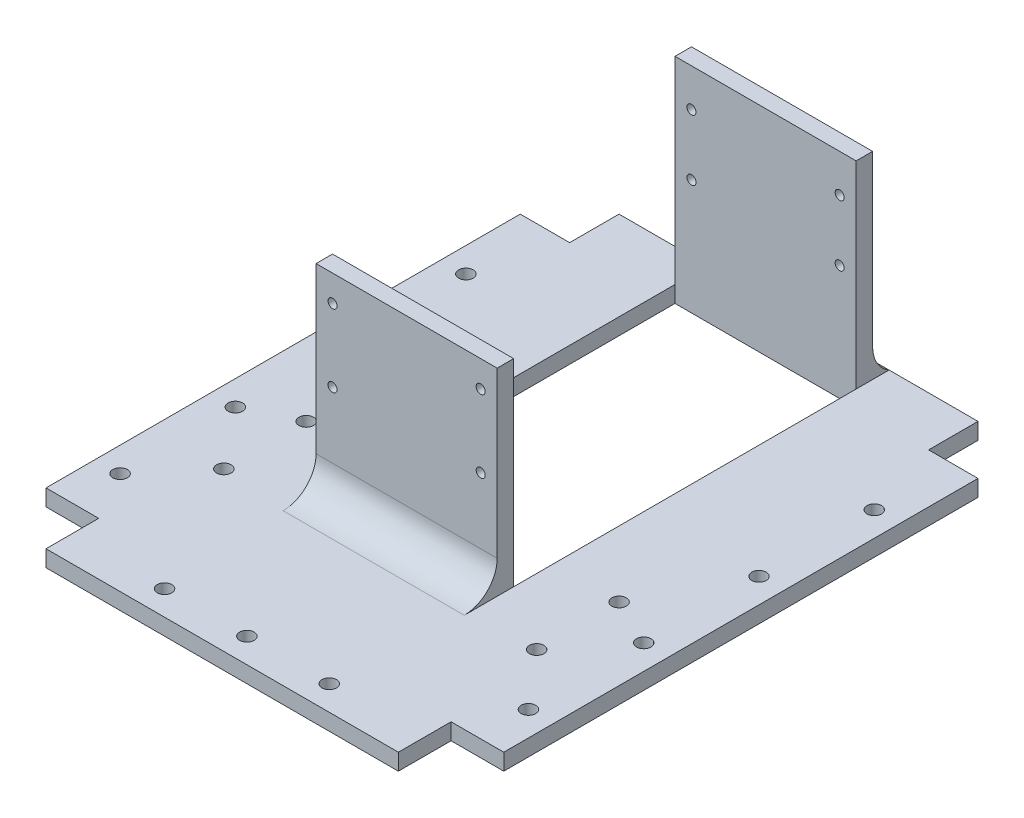
from build123d import *

# Parameters (mm, degrees)
SKETCH1_W               = 139
SKETCH1_H               = 160
BOSS_EXTRUDE1_DEPTH     = 5
SKETCH2_W               = 16
SKETCH2_H               = 16
CUT_EXTRUDE1_DEPTH      = 107.090763029
SKETCH3_R               = 2.2
CUT_EXTRUDE2_DEPTH      = 107.090763029
SKETCH4_R               = 2.2
CUT_EXTRUDE3_DEPTH      = 107.090763029
LPATTERN1_COUNT         = 4
LPATTERN1_PITCH         = 35
MIRROR2_COPY_1_SKETCH_R = 2.2
MIRROR2_COPY_1_DEPTH    = 107.090763029
MIRROR2_COPY_2_SKETCH_R = 2.2
MIRROR2_COPY_2_DEPTH    = 107.090763029
MIRROR2_COPY_3_SKETCH_R = 2.2
MIRROR2_COPY_3_DEPTH    = 107.090763029
SKETCH5_R               = 2.2
CUT_EXTRUDE4_DEPTH      = 107.090763029
SKETCH10_W              = 109
SKETCH10_H              = 15
BOSS_EXTRUDE2_DEPTH     = 5
SKETCH9_W               = 55
SKETCH9_H               = 104
CUT_EXTRUDE5_DEPTH      = 118.814472795
SKETCH11_W              = 55
SKETCH11_H              = 5
BOSS_EXTRUDE3_DEPTH     = 60
SKETCH12_R              = 1.375
CUT_EXTRUDE6_DEPTH      = 153.368796018
CUT_EXTRUDE7_REACH      = 154.369
SKETCH13_R              = 1.375
CUT_EXTRUDE8_REACH      = 196.821
SKETCH14_R              = 1.375
FILLET1_R               = 10
FILLET2_R               = 10


with BuildPart() as part:
    # Sketch1 → Boss-Extrude1 (new body)
    with BuildSketch(Plane(origin=(0, 0, 0), x_dir=(1, 0, 0), z_dir=(0, 1, 0))):
        Rectangle(SKETCH1_W, SKETCH1_H)
    extrude(amount=BOSS_EXTRUDE1_DEPTH)

    # Sketch2 → Cut-Extrude1 (cut, through all)
    with BuildSketch(Plane(origin=(0, 5, 0), x_dir=(1, 0, 0), z_dir=(0, 1, 0))):
        with Locations((-61.5, -72)):
            Rectangle(SKETCH2_W, SKETCH2_H)
    cut_extrude1 = extrude(amount=-CUT_EXTRUDE1_DEPTH, mode=Mode.SUBTRACT)

    # Mirror1: Cut-Extrude1 across plane
    add(cut_extrude1.mirror(Plane(origin=(0, 0, 0), x_dir=(0, 0, 1), z_dir=(1, 0, 0))), mode=Mode.SUBTRACT)

    # Sketch3 → Cut-Extrude2 (cut, through all)
    with BuildSketch(Plane(origin=(0, 5, 0), x_dir=(1, 0, 0), z_dir=(0, 1, 0))):
        with Locations(Location((0, -72.5, 0), (0, 0, 270))):
            Circle(SKETCH3_R)
        with Locations(Location((-25, -72.5, 0), (0, 0, 270))):
            Circle(SKETCH3_R)
        with Locations(Location((25, -72.5, 0), (0, 0, 270))):
            Circle(SKETCH3_R)
    extrude(amount=-CUT_EXTRUDE2_DEPTH, mode=Mode.SUBTRACT)

    # Sketch4 → Cut-Extrude3 (cut, through all)
    with BuildSketch(Plane(origin=(0, 5, 0), x_dir=(1, 0, 0), z_dir=(0, 1, 0))):
        with Locations(Location((-62, -49, 0), (0, 0, 270))):
            Circle(SKETCH4_R)
    cut_extrude3 = extrude(amount=-CUT_EXTRUDE3_DEPTH, mode=Mode.SUBTRACT)

    # LPattern1: Cut-Extrude3 ×4
    with Locations(*[(0, 0, -i * LPATTERN1_PITCH) for i in range(1, LPATTERN1_COUNT)]):
        add(cut_extrude3, mode=Mode.SUBTRACT)

    # Mirror2: Cut-Extrude3 across plane
    add(cut_extrude3.mirror(Plane(origin=(0, 0, 0), x_dir=(0, 0, 1), z_dir=(1, 0, 0))), mode=Mode.SUBTRACT)

    # Mirror2 copy 1 sketch → Mirror2 copy 1 (cut, through all)
    with BuildSketch(Plane(origin=(0, 5, -35), x_dir=(-1, 0, 0), z_dir=(0, 1, 0))):
        with Locations((-62, 49)):
            Circle(MIRROR2_COPY_1_SKETCH_R)
    extrude(amount=-MIRROR2_COPY_1_DEPTH, mode=Mode.SUBTRACT)

    # Mirror2 copy 2 sketch → Mirror2 copy 2 (cut, through all)
    with BuildSketch(Plane(origin=(0, 5, -70), x_dir=(-1, 0, 0), z_dir=(0, 1, 0))):
        with Locations((-62, 49)):
            Circle(MIRROR2_COPY_2_SKETCH_R)
    extrude(amount=-MIRROR2_COPY_2_DEPTH, mode=Mode.SUBTRACT)

    # Mirror2 copy 3 sketch → Mirror2 copy 3 (cut, through all)
    with BuildSketch(Plane(origin=(0, 5, -105), x_dir=(-1, 0, 0), z_dir=(0, 1, 0))):
        with Locations((-62, 49)):
            Circle(MIRROR2_COPY_3_SKETCH_R)
    extrude(amount=-MIRROR2_COPY_3_DEPTH, mode=Mode.SUBTRACT)

    # Sketch5 → Cut-Extrude4 (cut, through all)
    with BuildSketch(Plane(origin=(0, 5, 0), x_dir=(1, 0, 0), z_dir=(0, 1, 0))):
        with Locations(Location((-47.5, -32, 0), (0, 0, 270))):
            Circle(SKETCH5_R)
        with Locations(Location((-47.5, -7, 0), (0, 0, 270))):
            Circle(SKETCH5_R)
    cut_extrude4 = extrude(amount=-CUT_EXTRUDE4_DEPTH, mode=Mode.SUBTRACT)

    # Mirror3: Cut-Extrude4 across plane
    add(cut_extrude4.mirror(Plane(origin=(0, 0, 0), x_dir=(0, 0, 1), z_dir=(1, 0, 0))), mode=Mode.SUBTRACT)

    # Sketch10 → Boss-Extrude2 (add)
    with BuildSketch(Plane(origin=(0, 5, 0), x_dir=(1, 0, 0), z_dir=(0, 1, 0))):
        with Locations((0, 87.5)):
            Rectangle(SKETCH10_W, SKETCH10_H)
    extrude(amount=-BOSS_EXTRUDE2_DEPTH)

    # Sketch9 → Cut-Extrude5 (cut, through all)
    with BuildSketch(Plane(origin=(0, 5, 0), x_dir=(1, 0, 0), z_dir=(0, 1, 0))):
        with Locations((0, 33)):
            Rectangle(SKETCH9_W, SKETCH9_H)
    extrude(amount=-CUT_EXTRUDE5_DEPTH, mode=Mode.SUBTRACT)

    # Sketch11 → Boss-Extrude3 (add)
    with BuildSketch(Plane(origin=(0, 5, 0), x_dir=(1, 0, 0), z_dir=(0, 1, 0))):
        with Locations((0, 87.5)):
            Rectangle(SKETCH11_W, SKETCH11_H)
        with Locations((0, -21.5)):
            Rectangle(SKETCH11_W, SKETCH11_H)
    extrude(amount=BOSS_EXTRUDE3_DEPTH)

    # Sketch12 → Cut-Extrude6 (cut, through all)
    with BuildSketch(Plane.XY.offset(24)):
        with Locations((-22.5, 35)):
            Circle(SKETCH12_R)
        with Locations((22.5, 35)):
            Circle(SKETCH12_R)
    extrude(amount=-CUT_EXTRUDE6_DEPTH, mode=Mode.SUBTRACT)

    # Sketch13 → Cut-Extrude7 (cut, up to next)
    with BuildSketch(Plane.XY.offset(24), mode=Mode.PRIVATE) as cut_extrude7_sk1:
        with Locations((-22.5, 57)):
            Circle(SKETCH13_R)
    cut_extrude7_tool1 = extrude(cut_extrude7_sk1.sketch, amount=-CUT_EXTRUDE7_REACH, mode=Mode.PRIVATE) & part.part
    # Sketch13 → Cut-Extrude7 (cut, up to next)
    with BuildSketch(Plane.XY.offset(24), mode=Mode.PRIVATE) as cut_extrude7_sk2:
        with Locations((22.5, 57)):
            Circle(SKETCH13_R)
    cut_extrude7_tool2 = extrude(cut_extrude7_sk2.sketch, amount=-CUT_EXTRUDE7_REACH, mode=Mode.PRIVATE) & part.part
    add(cut_extrude7_tool1.solids().sort_by_distance((-22.5, 57, 24))[0], mode=Mode.SUBTRACT)
    add(cut_extrude7_tool2.solids().sort_by_distance((22.5, 57, 24))[0], mode=Mode.SUBTRACT)

    # Sketch14 → Cut-Extrude8 (cut, up to next)
    with BuildSketch(Plane(origin=(0, 0, -90), x_dir=(-1, 0, 0), z_dir=(0, 0, -1)), mode=Mode.PRIVATE) as cut_extrude8_sk1:
        with Locations((-22.5, 53.5)):
            Circle(SKETCH14_R)
    cut_extrude8_tool1 = extrude(cut_extrude8_sk1.sketch, amount=-CUT_EXTRUDE8_REACH, mode=Mode.PRIVATE) & part.part
    # Sketch14 → Cut-Extrude8 (cut, up to next)
    with BuildSketch(Plane(origin=(0, 0, -90), x_dir=(-1, 0, 0), z_dir=(0, 0, -1)), mode=Mode.PRIVATE) as cut_extrude8_sk2:
        with Locations((22.5, 53.5)):
            Circle(SKETCH14_R)
    cut_extrude8_tool2 = extrude(cut_extrude8_sk2.sketch, amount=-CUT_EXTRUDE8_REACH, mode=Mode.PRIVATE) & part.part
    add(cut_extrude8_tool1.solids().sort_by_distance((22.5, 53.5, -90))[0], mode=Mode.SUBTRACT)
    add(cut_extrude8_tool2.solids().sort_by_distance((-22.5, 53.5, -90))[0], mode=Mode.SUBTRACT)

    # Fillet1
    fillet1_edges = [part.edges().sort_by_distance(p)[0] for p in [
        (0, 5, 24),
    ]]
    fillet(fillet1_edges, radius=FILLET1_R)

    # Fillet2
    # the kernel refuses this fillet: 10 mm, written as the material it adds along each edge
    with BuildSketch(Plane(origin=(27.5, 5, -90), x_dir=(0, 0, -1), z_dir=(-1, 0, 0))) as fillet2_piece_1:
        with BuildLine():
            CenterArc((10, -8.660254038), FILLET2_R, 120, 60)
            Line((0, -8.660254038), (-0.2, -8.660254038))
            Line((-0.2, -8.660254038), (-0.2, 0))
            Line((-0.2, 0), (0, 0.2))
            ThreePointArc((0, 0.2), (2.5, 0.2), (4.9, 0.173205081))
            Line((4.9, 0.173205081), (5, 0))
        make_face()
    extrude(amount=55)


solid = part.part
